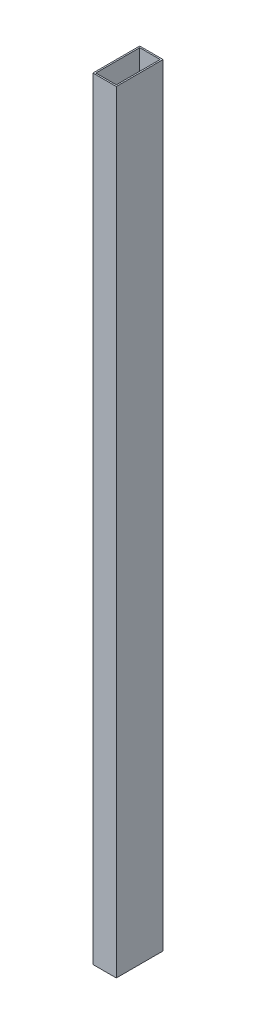
from build123d import *

# Parameters (mm, degrees)
SKETCH1_W           = 25.4
SKETCH1_H           = 50.8
SKETCH1_W_2         = 22.225
SKETCH1_H_2         = 47.625
EXTRUDE_THIN1_DEPTH = 838.2


with BuildPart() as part:
    # Sketch1 → Extrude-Thin1 (new body)
    with BuildSketch(Plane(origin=(0, 0, 0), x_dir=(1, 0, 0), z_dir=(0, 1, 0))):
        Rectangle(SKETCH1_W, SKETCH1_H)
        Rectangle(SKETCH1_W_2, SKETCH1_H_2, mode=Mode.SUBTRACT)
    extrude(amount=EXTRUDE_THIN1_DEPTH)


solid = part.part
